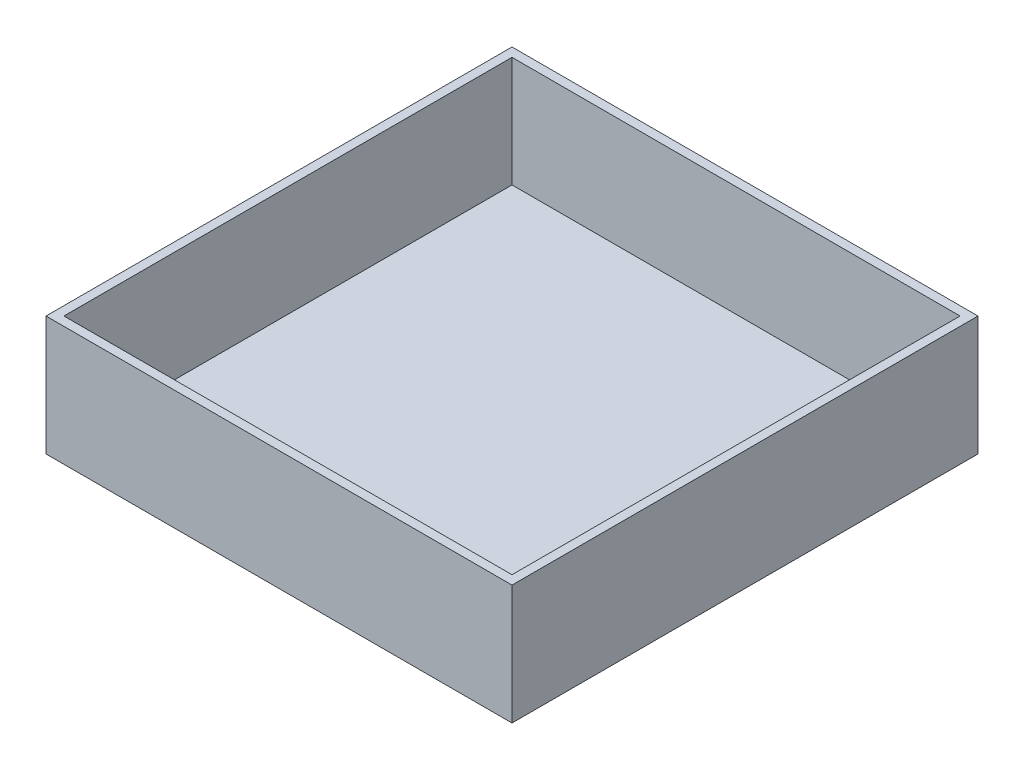
from build123d import *

# Parameters (mm, degrees)
SKETCH2_W           = 156
SKETCH2_H           = 156
SKETCH2_W_2         = 150
SKETCH2_H_2         = 150
BOSS_EXTRUDE1_DEPTH = 40
SKETCH2_2_W         = 150
SKETCH2_2_H         = 150
BOSS_EXTRUDE2_DEPTH = 3


with BuildPart() as part:
    # Sketch2 → Boss-Extrude1 (new body)
    with BuildSketch(Plane(origin=(0, 0, 0), x_dir=(1, 0, 0), z_dir=(0, 1, 0))):
        Rectangle(SKETCH2_W, SKETCH2_H)
        Rectangle(SKETCH2_W_2, SKETCH2_H_2, mode=Mode.SUBTRACT)
    extrude(amount=BOSS_EXTRUDE1_DEPTH)

    # Sketch2<2> → Boss-Extrude2 (add)
    with BuildSketch(Plane(origin=(0, 0, 0), x_dir=(1, 0, 0), z_dir=(0, 1, 0))):
        Rectangle(SKETCH2_2_W, SKETCH2_2_H)
    extrude(amount=BOSS_EXTRUDE2_DEPTH)


solid = part.part
